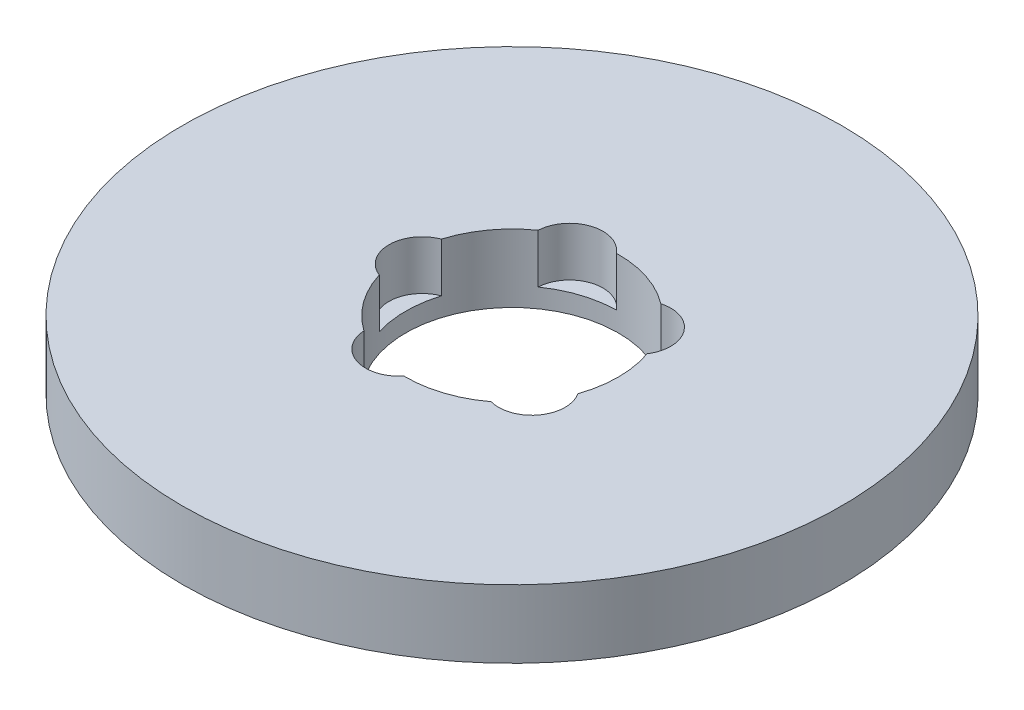
from build123d import *

# Parameters (mm, degrees)
SKETCH1_R           = 77.5
BOSS_EXTRUDE1_DEPTH = 16
SKETCH2_R           = 25
CUT_EXTRUDE1_DEPTH  = 111.763261057
SKETCH3_R           = 7.814873254
CUT_EXTRUDE2_DEPTH  = 11.559162494
CIRPATTERN1_COUNT   = 5


with BuildPart() as part:
    # Sketch1 → Boss-Extrude1 (new body)
    with BuildSketch(Plane(origin=(0, 0, 0), x_dir=(1, 0, 0), z_dir=(0, 1, 0))):
        Circle(SKETCH1_R)
    extrude(amount=BOSS_EXTRUDE1_DEPTH)

    # Sketch2 → Cut-Extrude1 (cut, through all)
    with BuildSketch(Plane(origin=(0, 0, 0), x_dir=(1, 0, 0), z_dir=(0, 1, 0))):
        Circle(SKETCH2_R)
    extrude(amount=CUT_EXTRUDE1_DEPTH, mode=Mode.SUBTRACT)

    # Sketch3 → Cut-Extrude2 (cut)
    with BuildSketch(Plane(origin=(0, 16, 0), x_dir=(1, 0, 0), z_dir=(0, 1, 0))):
        with Locations((-21.122639433, 0)):
            Circle(SKETCH3_R)
    cut_extrude2 = extrude(amount=-CUT_EXTRUDE2_DEPTH, mode=Mode.SUBTRACT)

    # CirPattern1: Cut-Extrude2 ×5 about axis
    cirpattern1_axis = Axis((0, 0, 0), (0, 1, 0))
    for i in range(1, CIRPATTERN1_COUNT):
        add(cut_extrude2.rotate(cirpattern1_axis, i * 360 / CIRPATTERN1_COUNT), mode=Mode.SUBTRACT)


solid = part.part
